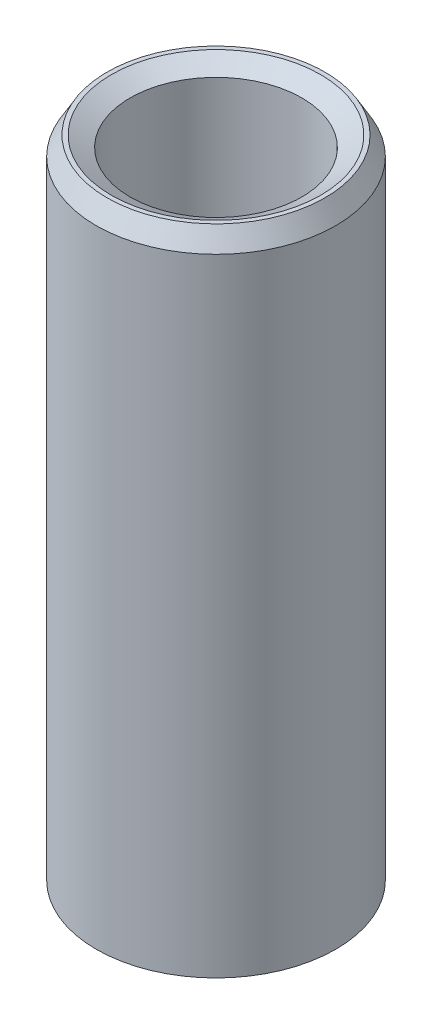
from build123d import *
from OCP.BRepFilletAPI import BRepFilletAPI_MakeChamfer

# Parameters (mm, degrees)
SKETCH1_R           = 25
BOSS_EXTRUDE1_DEPTH = 136.992967603
SKETCH2_R           = 17.928040959
CUT_EXTRUDE1_DEPTH  = 142.481706141
CHAMFER1_SIZE       = 3.909273963
CHAMFER1_SIZE2      = 2.257020375


with BuildPart() as part:
    # Sketch1 → Boss-Extrude1 (new body)
    with BuildSketch(Plane(origin=(0, 0, 0), x_dir=(1, 0, 0), z_dir=(0, 1, 0))):
        Circle(SKETCH1_R)
    extrude(amount=BOSS_EXTRUDE1_DEPTH)

    # Sketch2 → Cut-Extrude1 (cut, through all)
    with BuildSketch(Plane(origin=(0, 0, 0), x_dir=(1, 0, 0), z_dir=(0, 1, 0))):
        Circle(SKETCH2_R)
    extrude(amount=CUT_EXTRUDE1_DEPTH, mode=Mode.SUBTRACT)

    # Chamfer1: one chamfer whose edges measure the first distance from different faces: ONE call of the kernel's chamfer builder (chamfer() names one face for all edges)
    chamfer1_edges_1 = [part.edges().sort_by_distance(p)[0] for p in [
        (-17.928040959, 136.992967603, 0),
    ]]
    chamfer1_side_1 = [part.faces().sort_by_distance(p)[0] for p in [
        (-24.292893219, 136.992967603, 0),
    ]]
    chamfer1_edges_2 = [part.edges().sort_by_distance(p)[0] for p in [
        (-17.928040959, 0, 0),
    ]]
    chamfer1_side_2 = [part.faces().sort_by_distance(p)[0] for p in [
        (-17.928040959, 68.496483802, 0),
    ]]
    chamfer1_edges_3 = [part.edges().sort_by_distance(p)[0] for p in [
        (-25, 0, 0),
    ]]
    chamfer1_side_3 = [part.faces().sort_by_distance(p)[0] for p in [
        (-24.292893219, 0, 0),
    ]]
    chamfer1_edges_4 = [part.edges().sort_by_distance(p)[0] for p in [
        (-25, 136.992967603, 0),
    ]]
    chamfer1_side_4 = [part.faces().sort_by_distance(p)[0] for p in [
        (-25, 68.496483802, 0),
    ]]
    chamfer1 = BRepFilletAPI_MakeChamfer(part.part.solid().wrapped)
    for e in chamfer1_edges_1:
        chamfer1.Add(CHAMFER1_SIZE, CHAMFER1_SIZE2, e.wrapped, chamfer1_side_1[0].wrapped)  # the first distance lies on this face
    for e in chamfer1_edges_2:
        chamfer1.Add(CHAMFER1_SIZE, CHAMFER1_SIZE2, e.wrapped, chamfer1_side_2[0].wrapped)  # the first distance lies on this face
    for e in chamfer1_edges_3:
        chamfer1.Add(CHAMFER1_SIZE, CHAMFER1_SIZE2, e.wrapped, chamfer1_side_3[0].wrapped)  # the first distance lies on this face
    for e in chamfer1_edges_4:
        chamfer1.Add(CHAMFER1_SIZE, CHAMFER1_SIZE2, e.wrapped, chamfer1_side_4[0].wrapped)  # the first distance lies on this face
    add(Compound.cast(chamfer1.Shape()), mode=Mode.REPLACE)


solid = part.part
